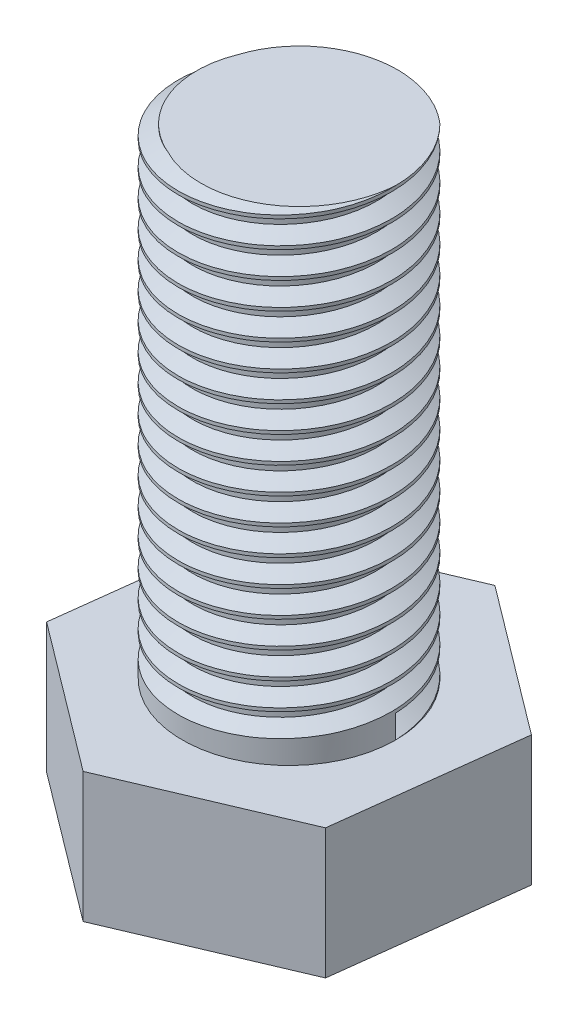
from build123d import *
from build123d.topology import SkipClean

# Parameters (mm, degrees)
SKETCH2_R           = 12.7
BOSS_EXTRUDE1_DEPTH = 57.15
THREAD1_PITCH       = 3.175
BOSS_EXTRUDE2_DEPTH = 15.478125


with BuildPart() as part:
    # Sketch2 → Boss-Extrude1 (new body)
    with BuildSketch(Plane(origin=(0, 0, 0), x_dir=(1, 0, 0), z_dir=(0, 1, 0))):
        with Locations(Location((0, 0, 0), (0, 0, 270))):
            Circle(SKETCH2_R)
    extrude(amount=BOSS_EXTRUDE1_DEPTH)

    # Thread1: the profile of Thread Profile1 profile screwed along a right-hand helix of 18 turns, 12 arcs to a turn; built about Z, then put on its axis
    with SkipClean():  # the faces are left unmerged after this step: merging them gives an invalid solid
        thread1_z = Axis((0, 0, 0), (0, 0, 1))
        thread1_corners = [(12.7003, 0, -0.000173205), (12.7003, 0, 2.778298196), (10.981480847, 0, 1.785937496), (10.981480847, 0, 0.992187496)]
        with BuildLine(mode=Mode.PRIVATE) as thread1_profile:
            Line(thread1_corners[0], thread1_corners[1])
            Line(thread1_corners[1], thread1_corners[2])
            Line(thread1_corners[2], thread1_corners[3])
            Line(thread1_corners[3], thread1_corners[0])
        thread1_cap = Face(thread1_profile.wire())
        thread1_turn_angles = [0, 15, 30, 45, 60, 75, 90, 105, 120, 135, 150, 165, 180, 195, 210, 225, 240, 255, 270, 285, 300, 315, 330, 345, 360]
        thread1_turn_weights = [1, 0.9659258262890683, 1, 0.9659258262890683, 1, 0.9659258262890683, 1, 0.9659258262890683, 1, 0.9659258262890683, 1, 0.9659258262890683, 1, 0.9659258262890683, 1, 0.9659258262890683, 1, 0.9659258262890683, 1, 0.9659258262890683, 1, 0.9659258262890683, 1, 0.9659258262890683, 1]
        thread1_turn_rails = [Edge.make_bspline([Vector(p[0], p[1], 0).rotate(thread1_z, thread1_turn_angles[k]) / thread1_turn_weights[k] + Vector(0, 0, p[2] + THREAD1_PITCH * thread1_turn_angles[k] / 360) for k in range(25)], [0, 0, 0, 1, 1, 2, 2, 3, 3, 4, 4, 5, 5, 6, 6, 7, 7, 8, 8, 9, 9, 10, 10, 11, 11, 12, 12, 12], 2, thread1_turn_weights) for p in thread1_corners]
        thread1_turn_sides = [Face.make_surface_from_curves(thread1_turn_rails[p[0]], thread1_turn_rails[p[1]]) for p in [(0, 1), (1, 2), (2, 3), (3, 0)]]
        thread1 = Plane(origin=(0, 0, 0), x_dir=(1, 0, 0), z_dir=(0, 1, 0)) * Solid(Shell([*[p.moved(Location((0, 0, THREAD1_PITCH * i))) for i in range(18) for p in thread1_turn_sides], thread1_cap, thread1_cap.rotate(thread1_z, 6480).moved(Location((0, 0, THREAD1_PITCH * 6480 / 360)))]))
        add(thread1, mode=Mode.SUBTRACT)

    # Sketch6 → Boss-Extrude2 (add)
    with SkipClean():  # the faces are left unmerged after this step: merging them gives an invalid solid
        with BuildSketch(Plane.XZ):
            Polygon((17.574932896, 13.228444115), (-2.668702208, 21.834560415), (-20.243635104, 8.6061163), (-17.574932896, -13.228444115), (2.668702208, -21.834560415), (20.243635104, -8.6061163), align=None)
        extrude(amount=BOSS_EXTRUDE2_DEPTH)


solid = part.part
